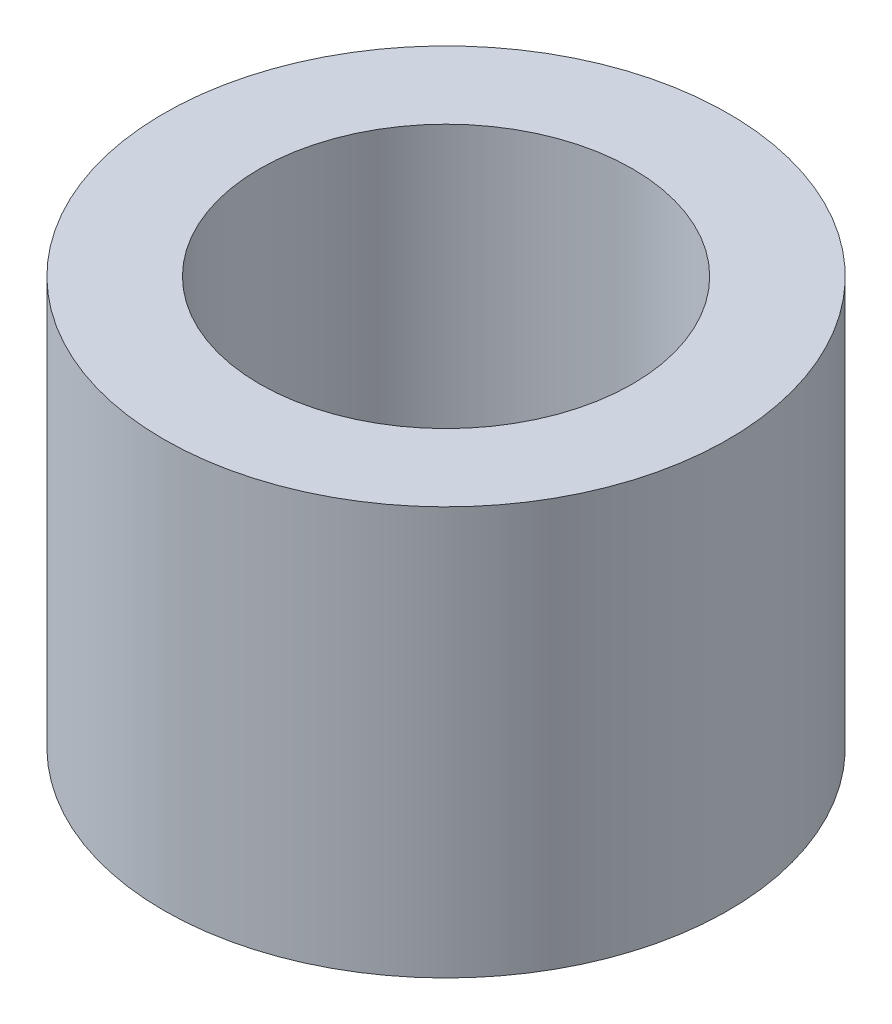
from build123d import *

# Parameters (mm, degrees)
SKETCH1_R           = 20
BOSS_EXTRUDE1_DEPTH = 28.911122775
SKETCH2_R           = 13.208930644
CUT_EXTRUDE1_DEPTH  = 41.44567987


with BuildPart() as part:
    # Sketch1 → Boss-Extrude1 (new body)
    with BuildSketch(Plane(origin=(0, 0, 0), x_dir=(1, 0, 0), z_dir=(0, 1, 0))):
        Circle(SKETCH1_R)
    extrude(amount=BOSS_EXTRUDE1_DEPTH)

    # Sketch2 → Cut-Extrude1 (cut, through all)
    with BuildSketch(Plane(origin=(0, 0, 0), x_dir=(1, 0, 0), z_dir=(0, 1, 0))):
        Circle(SKETCH2_R)
    extrude(amount=CUT_EXTRUDE1_DEPTH, mode=Mode.SUBTRACT)


solid = part.part
